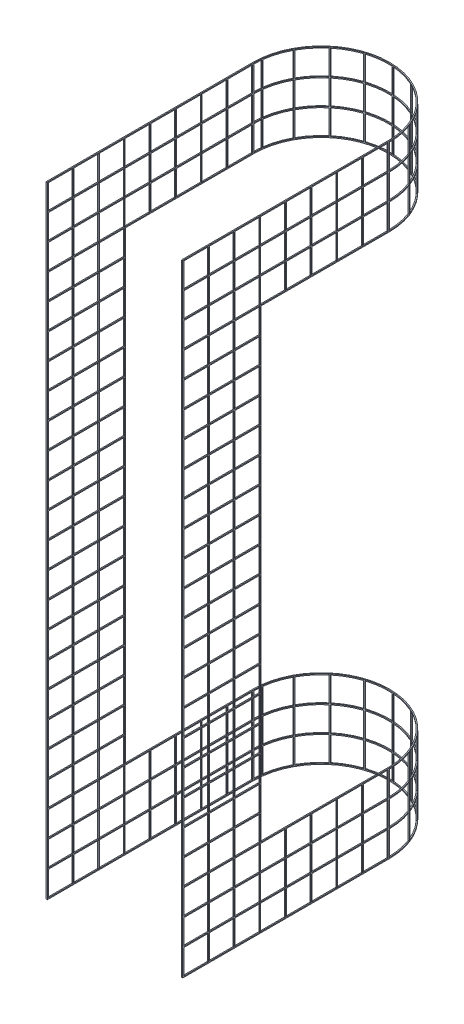
from build123d import *

# Parameters (mm, degrees)
BOSS_EXTRUDE1_DEPTH = 300.5
SKETCH2_W           = 12
SKETCH2_H           = 12
CUT_EXTRUDE2_DEPTH  = 324.506182321
WRAP3_START         = 0.5
WRAP3_DEPTH         = 12
WRAP3_START_2       = 13
WRAP3_2_DEPTH       = 12
WRAP3_START_3       = 25.5
WRAP3_3_DEPTH       = 12
WRAP3_START_4       = 263
WRAP3_4_DEPTH       = 12
WRAP3_START_5       = 275.5
WRAP3_5_DEPTH       = 12
WRAP3_START_6       = 288
WRAP3_6_DEPTH       = 12
SKETCH8_W           = 145.302396336
SKETCH8_H           = 224.5
CUT_EXTRUDE3_DEPTH  = 324.506182321


# Read off the part's stored shape, not the designer's step: Wrap3
with BuildPart() as part:
    # Sketch1 → Boss-Extrude1 (new body)
    with BuildSketch(Plane(origin=(0, 0, 0), x_dir=(1, 0, 0), z_dir=(0, 1, 0))):
        with BuildLine():
            Line((0, 0), (0, -100))
            Line((0, -100), (-0.5, -100))
            Line((-0.5, -100), (-0.5, 0))
            ThreePointArc((-0.5, 0), (32.5, 33), (65.5, 0))
            Line((65.5, 0), (65.5, -100))
            Line((65.5, -100), (65, -100))
            Line((65, -100), (65, 0))
            ThreePointArc((65, 0), (32.5, 32.5), (0, 0))
        make_face()
    extrude(amount=BOSS_EXTRUDE1_DEPTH)

    # Sketch2 → Cut-Extrude2 (cut, through all)
    with BuildSketch(Plane(origin=(65.5, 0, 0), x_dir=(0, 0, -1), z_dir=(1, 0, 0))):
        with Locations((-93.5, 294)):
            Rectangle(SKETCH2_W, SKETCH2_H)
        with Locations((-93.5, 281.5)):
            Rectangle(SKETCH2_W, SKETCH2_H)
        with Locations((-93.5, 269)):
            Rectangle(SKETCH2_W, SKETCH2_H)
        with Locations((-93.5, 256.5)):
            Rectangle(SKETCH2_W, SKETCH2_H)
        with Locations((-93.5, 244)):
            Rectangle(SKETCH2_W, SKETCH2_H)
        with Locations((-93.5, 231.5)):
            Rectangle(SKETCH2_W, SKETCH2_H)
        with Locations((-93.5, 219)):
            Rectangle(SKETCH2_W, SKETCH2_H)
        with Locations((-93.5, 206.5)):
            Rectangle(SKETCH2_W, SKETCH2_H)
        with Locations((-93.5, 194)):
            Rectangle(SKETCH2_W, SKETCH2_H)
        with Locations((-93.5, 181.5)):
            Rectangle(SKETCH2_W, SKETCH2_H)
        with Locations((-93.5, 169)):
            Rectangle(SKETCH2_W, SKETCH2_H)
        with Locations((-93.5, 156.5)):
            Rectangle(SKETCH2_W, SKETCH2_H)
        with Locations((-93.5, 144)):
            Rectangle(SKETCH2_W, SKETCH2_H)
        with Locations((-93.5, 131.5)):
            Rectangle(SKETCH2_W, SKETCH2_H)
        with Locations((-93.5, 119)):
            Rectangle(SKETCH2_W, SKETCH2_H)
        with Locations((-93.5, 106.5)):
            Rectangle(SKETCH2_W, SKETCH2_H)
        with Locations((-93.5, 94)):
            Rectangle(SKETCH2_W, SKETCH2_H)
        with Locations((-93.5, 81.5)):
            Rectangle(SKETCH2_W, SKETCH2_H)
        with Locations((-93.5, 69)):
            Rectangle(SKETCH2_W, SKETCH2_H)
        with Locations((-93.5, 56.5)):
            Rectangle(SKETCH2_W, SKETCH2_H)
        with Locations((-93.5, 44)):
            Rectangle(SKETCH2_W, SKETCH2_H)
        with Locations((-93.5, 31.5)):
            Rectangle(SKETCH2_W, SKETCH2_H)
        with Locations((-93.5, 19)):
            Rectangle(SKETCH2_W, SKETCH2_H)
        with Locations((-93.5, 6.5)):
            Rectangle(SKETCH2_W, SKETCH2_H)
        with Locations((-81.098058449, 294)):
            Rectangle(SKETCH2_W, SKETCH2_H)
        with Locations((-68.696116898, 294)):
            Rectangle(SKETCH2_W, SKETCH2_H)
        with Locations((-56.294175346, 294)):
            Rectangle(SKETCH2_W, SKETCH2_H)
        with Locations((-43.892233795, 294)):
            Rectangle(SKETCH2_W, SKETCH2_H)
        with Locations((-31.490292244, 294)):
            Rectangle(SKETCH2_W, SKETCH2_H)
        with Locations((-19.088350693, 294)):
            Rectangle(SKETCH2_W, SKETCH2_H)
        with Locations((-6.686409141, 294)):
            Rectangle(SKETCH2_W, SKETCH2_H)
        with Locations((-81.098058449, 281.5)):
            Rectangle(SKETCH2_W, SKETCH2_H)
        with Locations((-68.696116898, 281.5)):
            Rectangle(SKETCH2_W, SKETCH2_H)
        with Locations((-56.294175346, 281.5)):
            Rectangle(SKETCH2_W, SKETCH2_H)
        with Locations((-43.892233795, 281.5)):
            Rectangle(SKETCH2_W, SKETCH2_H)
        with Locations((-31.490292244, 281.5)):
            Rectangle(SKETCH2_W, SKETCH2_H)
        with Locations((-19.088350693, 281.5)):
            Rectangle(SKETCH2_W, SKETCH2_H)
        with Locations((-6.686409141, 281.5)):
            Rectangle(SKETCH2_W, SKETCH2_H)
        with Locations((-81.098058449, 269)):
            Rectangle(SKETCH2_W, SKETCH2_H)
        with Locations((-68.696116898, 269)):
            Rectangle(SKETCH2_W, SKETCH2_H)
        with Locations((-56.294175346, 269)):
            Rectangle(SKETCH2_W, SKETCH2_H)
        with Locations((-43.892233795, 269)):
            Rectangle(SKETCH2_W, SKETCH2_H)
        with Locations((-31.490292244, 269)):
            Rectangle(SKETCH2_W, SKETCH2_H)
        with Locations((-19.088350693, 269)):
            Rectangle(SKETCH2_W, SKETCH2_H)
        with Locations((-6.686409141, 269)):
            Rectangle(SKETCH2_W, SKETCH2_H)
        with Locations((-81.098058449, 256.5)):
            Rectangle(SKETCH2_W, SKETCH2_H)
        with Locations((-68.696116898, 256.5)):
            Rectangle(SKETCH2_W, SKETCH2_H)
        with Locations((-81.098058449, 244)):
            Rectangle(SKETCH2_W, SKETCH2_H)
        with Locations((-68.696116898, 244)):
            Rectangle(SKETCH2_W, SKETCH2_H)
        with Locations((-81.098058449, 231.5)):
            Rectangle(SKETCH2_W, SKETCH2_H)
        with Locations((-68.696116898, 231.5)):
            Rectangle(SKETCH2_W, SKETCH2_H)
        with Locations((-81.098058449, 219)):
            Rectangle(SKETCH2_W, SKETCH2_H)
        with Locations((-68.696116898, 219)):
            Rectangle(SKETCH2_W, SKETCH2_H)
        with Locations((-81.098058449, 206.5)):
            Rectangle(SKETCH2_W, SKETCH2_H)
        with Locations((-68.696116898, 206.5)):
            Rectangle(SKETCH2_W, SKETCH2_H)
        with Locations((-81.098058449, 194)):
            Rectangle(SKETCH2_W, SKETCH2_H)
        with Locations((-68.696116898, 194)):
            Rectangle(SKETCH2_W, SKETCH2_H)
        with Locations((-81.098058449, 181.5)):
            Rectangle(SKETCH2_W, SKETCH2_H)
        with Locations((-68.696116898, 181.5)):
            Rectangle(SKETCH2_W, SKETCH2_H)
        with Locations((-81.098058449, 169)):
            Rectangle(SKETCH2_W, SKETCH2_H)
        with Locations((-68.696116898, 169)):
            Rectangle(SKETCH2_W, SKETCH2_H)
        with Locations((-81.098058449, 156.5)):
            Rectangle(SKETCH2_W, SKETCH2_H)
        with Locations((-68.696116898, 156.5)):
            Rectangle(SKETCH2_W, SKETCH2_H)
        with Locations((-81.098058449, 144)):
            Rectangle(SKETCH2_W, SKETCH2_H)
        with Locations((-68.696116898, 144)):
            Rectangle(SKETCH2_W, SKETCH2_H)
        with Locations((-81.098058449, 131.5)):
            Rectangle(SKETCH2_W, SKETCH2_H)
        with Locations((-68.696116898, 131.5)):
            Rectangle(SKETCH2_W, SKETCH2_H)
        with Locations((-81.098058449, 119)):
            Rectangle(SKETCH2_W, SKETCH2_H)
        with Locations((-68.696116898, 119)):
            Rectangle(SKETCH2_W, SKETCH2_H)
        with Locations((-81.098058449, 106.5)):
            Rectangle(SKETCH2_W, SKETCH2_H)
        with Locations((-68.696116898, 106.5)):
            Rectangle(SKETCH2_W, SKETCH2_H)
        with Locations((-81.098058449, 94)):
            Rectangle(SKETCH2_W, SKETCH2_H)
        with Locations((-68.696116898, 94)):
            Rectangle(SKETCH2_W, SKETCH2_H)
        with Locations((-81.098058449, 81.5)):
            Rectangle(SKETCH2_W, SKETCH2_H)
        with Locations((-68.696116898, 81.5)):
            Rectangle(SKETCH2_W, SKETCH2_H)
        with Locations((-81.098058449, 69)):
            Rectangle(SKETCH2_W, SKETCH2_H)
        with Locations((-68.696116898, 69)):
            Rectangle(SKETCH2_W, SKETCH2_H)
        with Locations((-81.098058449, 56.5)):
            Rectangle(SKETCH2_W, SKETCH2_H)
        with Locations((-68.696116898, 56.5)):
            Rectangle(SKETCH2_W, SKETCH2_H)
        with Locations((-81.098058449, 44)):
            Rectangle(SKETCH2_W, SKETCH2_H)
        with Locations((-68.696116898, 44)):
            Rectangle(SKETCH2_W, SKETCH2_H)
        with Locations((-81.098058449, 31.5)):
            Rectangle(SKETCH2_W, SKETCH2_H)
        with Locations((-68.696116898, 31.5)):
            Rectangle(SKETCH2_W, SKETCH2_H)
        with Locations((-56.294175346, 31.5)):
            Rectangle(SKETCH2_W, SKETCH2_H)
        with Locations((-43.892233795, 31.5)):
            Rectangle(SKETCH2_W, SKETCH2_H)
        with Locations((-31.490292244, 31.5)):
            Rectangle(SKETCH2_W, SKETCH2_H)
        with Locations((-19.088350693, 31.5)):
            Rectangle(SKETCH2_W, SKETCH2_H)
        with Locations((-6.686409141, 31.5)):
            Rectangle(SKETCH2_W, SKETCH2_H)
        with Locations((-81.098058449, 19)):
            Rectangle(SKETCH2_W, SKETCH2_H)
        with Locations((-68.696116898, 19)):
            Rectangle(SKETCH2_W, SKETCH2_H)
        with Locations((-56.294175346, 19)):
            Rectangle(SKETCH2_W, SKETCH2_H)
        with Locations((-43.892233795, 19)):
            Rectangle(SKETCH2_W, SKETCH2_H)
        with Locations((-31.490292244, 19)):
            Rectangle(SKETCH2_W, SKETCH2_H)
        with Locations((-19.088350693, 19)):
            Rectangle(SKETCH2_W, SKETCH2_H)
        with Locations((-6.686409141, 19)):
            Rectangle(SKETCH2_W, SKETCH2_H)
        with Locations((-81.098058449, 6.5)):
            Rectangle(SKETCH2_W, SKETCH2_H)
        with Locations((-68.696116898, 6.5)):
            Rectangle(SKETCH2_W, SKETCH2_H)
        with Locations((-56.294175346, 6.5)):
            Rectangle(SKETCH2_W, SKETCH2_H)
        with Locations((-43.892233795, 6.5)):
            Rectangle(SKETCH2_W, SKETCH2_H)
        with Locations((-31.490292244, 6.5)):
            Rectangle(SKETCH2_W, SKETCH2_H)
        with Locations((-19.088350693, 6.5)):
            Rectangle(SKETCH2_W, SKETCH2_H)
        with Locations((-6.686409141, 6.5)):
            Rectangle(SKETCH2_W, SKETCH2_H)
    extrude(amount=-CUT_EXTRUDE2_DEPTH, mode=Mode.SUBTRACT)

    # Wrap3 outline → Wrap3 (cut)
    with BuildSketch(Plane(origin=(0, 0, 0), x_dir=(1, 0, 0), z_dir=(0, 1, 0)).offset(WRAP3_START)):
        with BuildLine():
            ThreePointArc((0, 0), (0.050302626, 1.807523255), (0.201054789, 3.609451239))
            Line((0.201054789, 3.609451239), (-0.295852061, 3.664981258))
            ThreePointArc((-0.295852061, 3.664981258), (-0.448923488, 1.835331305), (-0.5, 0))
            Line((-0.5, 0), (0, 0))
        make_face()
        with BuildLine():
            Line((-0.236559792, 4.161448421), (0.259448689, 4.098396173))
            ThreePointArc((0.259448689, 4.098396173), (1.531948072, 9.86051519), (3.825367602, 15.297563755))
            Line((3.825367602, 15.297563755), (3.384219411, 15.53291089))
            ThreePointArc((3.384219411, 15.53291089), (1.055516504, 10.012215423), (-0.236559792, 4.161448421))
        make_face()
        with BuildLine():
            Line((3.622899509, 15.972259303), (4.060431335, 15.730255374))
            ThreePointArc((4.060431335, 15.730255374), (7.373527928, 20.613354923), (11.514965987, 24.816896411))
            Line((11.514965987, 24.816896411), (11.19211931, 25.198694818))
            ThreePointArc((11.19211931, 25.198694818), (6.986966819, 20.930483461), (3.622899509, 15.972259303))
        make_face()
        with BuildLine():
            Line((11.57634887, 25.518636786), (11.893373887, 25.131990774))
            ThreePointArc((11.893373887, 25.131990774), (16.777360404, 28.443779709), (22.179673341, 30.817865884))
            Line((22.179673341, 30.817865884), (22.020899085, 31.291986898))
            ThreePointArc((22.020899085, 31.291986898), (16.535473641, 28.88137632), (11.57634887, 25.518636786))
        make_face()
        with BuildLine():
            Line((22.49620477, 31.447163322), (22.647777425, 30.97069115))
            ThreePointArc((22.647777425, 30.97069115), (28.41023697, 32.241647575), (34.307523255, 32.449697374))
            Line((34.307523255, 32.449697374), (34.335331305, 32.948923488))
            ThreePointArc((34.335331305, 32.948923488), (28.347317539, 32.737672922), (22.49620477, 31.447163322))
        make_face()
        with BuildLine():
            Line((34.834327655, 32.917334558), (34.798959054, 32.418587065))
            ThreePointArc((34.798959054, 32.418587065), (40.622931071, 31.46852381), (46.17911537, 29.481041411))
            Line((46.17911537, 29.481041411), (46.389563298, 29.934595895))
            ThreePointArc((46.389563298, 29.934595895), (40.747899241, 31.952654946), (34.834327655, 32.917334558))
        make_face()
        with BuildLine():
            Line((46.841506156, 29.720720065), (46.624210608, 29.270406125))
            ThreePointArc((46.624210608, 29.270406125), (51.68401374, 26.234016407), (56.111379733, 22.332772938))
            Line((56.111379733, 22.332772938), (56.474631729, 22.67635406))
            ThreePointArc((56.474631729, 22.67635406), (51.979152412, 26.637616659), (46.841506156, 29.720720065))
        make_face()
        with BuildLine():
            Line((56.815447849, 22.310513125), (56.447031972, 21.972475047))
            ThreePointArc((56.447031972, 21.972475047), (60.025323293, 17.280236619), (62.696190499, 12.018322651))
            Line((62.696190499, 12.018322651), (63.160747276, 12.203219922))
            ThreePointArc((63.160747276, 12.203219922), (60.448789805, 17.546086413), (56.815447849, 22.310513125))
        make_face()
        with BuildLine():
            Line((63.342118171, 11.73728021), (62.87481335, 11.559442631))
            ThreePointArc((62.87481335, 11.559442631), (64.46428815, 5.876587705), (65, 0))
            Line((65, 0), (65.5, 0))
            ThreePointArc((65.5, 0), (64.956046429, 5.966996747), (63.342118171, 11.73728021))
        make_face()
    extrude(amount=WRAP3_DEPTH, mode=Mode.SUBTRACT)

    # Wrap3 2 outline → Wrap3 2 (cut)
    with BuildSketch(Plane(origin=(0, 0, 0), x_dir=(1, 0, 0), z_dir=(0, 1, 0)).offset(WRAP3_START_2)):
        with BuildLine():
            ThreePointArc((0, 0), (0.050302626, 1.807523255), (0.201054789, 3.609451239))
            Line((0.201054789, 3.609451239), (-0.295852061, 3.664981258))
            ThreePointArc((-0.295852061, 3.664981258), (-0.448923488, 1.835331305), (-0.5, 0))
            Line((-0.5, 0), (0, 0))
        make_face()
        with BuildLine():
            Line((-0.236559792, 4.161448421), (0.259448689, 4.098396173))
            ThreePointArc((0.259448689, 4.098396173), (1.531948072, 9.86051519), (3.825367602, 15.297563755))
            Line((3.825367602, 15.297563755), (3.384219411, 15.53291089))
            ThreePointArc((3.384219411, 15.53291089), (1.055516504, 10.012215423), (-0.236559792, 4.161448421))
        make_face()
        with BuildLine():
            Line((3.622899509, 15.972259303), (4.060431335, 15.730255374))
            ThreePointArc((4.060431335, 15.730255374), (7.373527928, 20.613354923), (11.514965987, 24.816896411))
            Line((11.514965987, 24.816896411), (11.19211931, 25.198694818))
            ThreePointArc((11.19211931, 25.198694818), (6.986966819, 20.930483461), (3.622899509, 15.972259303))
        make_face()
        with BuildLine():
            Line((11.57634887, 25.518636786), (11.893373887, 25.131990774))
            ThreePointArc((11.893373887, 25.131990774), (16.777360404, 28.443779709), (22.179673341, 30.817865884))
            Line((22.179673341, 30.817865884), (22.020899085, 31.291986898))
            ThreePointArc((22.020899085, 31.291986898), (16.535473641, 28.88137632), (11.57634887, 25.518636786))
        make_face()
        with BuildLine():
            Line((22.49620477, 31.447163322), (22.647777425, 30.97069115))
            ThreePointArc((22.647777425, 30.97069115), (28.41023697, 32.241647575), (34.307523255, 32.449697374))
            Line((34.307523255, 32.449697374), (34.335331305, 32.948923488))
            ThreePointArc((34.335331305, 32.948923488), (28.347317539, 32.737672922), (22.49620477, 31.447163322))
        make_face()
        with BuildLine():
            Line((34.834327655, 32.917334558), (34.798959054, 32.418587065))
            ThreePointArc((34.798959054, 32.418587065), (40.622931071, 31.46852381), (46.17911537, 29.481041411))
            Line((46.17911537, 29.481041411), (46.389563298, 29.934595895))
            ThreePointArc((46.389563298, 29.934595895), (40.747899241, 31.952654946), (34.834327655, 32.917334558))
        make_face()
        with BuildLine():
            Line((46.841506156, 29.720720065), (46.624210608, 29.270406125))
            ThreePointArc((46.624210608, 29.270406125), (51.68401374, 26.234016407), (56.111379733, 22.332772938))
            Line((56.111379733, 22.332772938), (56.474631729, 22.67635406))
            ThreePointArc((56.474631729, 22.67635406), (51.979152412, 26.637616659), (46.841506156, 29.720720065))
        make_face()
        with BuildLine():
            Line((56.815447849, 22.310513125), (56.447031972, 21.972475047))
            ThreePointArc((56.447031972, 21.972475047), (60.025323293, 17.280236619), (62.696190499, 12.018322651))
            Line((62.696190499, 12.018322651), (63.160747276, 12.203219922))
            ThreePointArc((63.160747276, 12.203219922), (60.448789805, 17.546086413), (56.815447849, 22.310513125))
        make_face()
        with BuildLine():
            Line((63.342118171, 11.73728021), (62.87481335, 11.559442631))
            ThreePointArc((62.87481335, 11.559442631), (64.46428815, 5.876587705), (65, 0))
            Line((65, 0), (65.5, 0))
            ThreePointArc((65.5, 0), (64.956046429, 5.966996747), (63.342118171, 11.73728021))
        make_face()
    extrude(amount=WRAP3_2_DEPTH, mode=Mode.SUBTRACT)

    # Wrap3 3 outline → Wrap3 3 (cut)
    with BuildSketch(Plane(origin=(0, 0, 0), x_dir=(1, 0, 0), z_dir=(0, 1, 0)).offset(WRAP3_START_3)):
        with BuildLine():
            ThreePointArc((0, 0), (0.050302626, 1.807523255), (0.201054789, 3.609451239))
            Line((0.201054789, 3.609451239), (-0.295852061, 3.664981258))
            ThreePointArc((-0.295852061, 3.664981258), (-0.448923488, 1.835331305), (-0.5, 0))
            Line((-0.5, 0), (0, 0))
        make_face()
        with BuildLine():
            Line((-0.236559792, 4.161448421), (0.259448689, 4.098396173))
            ThreePointArc((0.259448689, 4.098396173), (1.531948072, 9.86051519), (3.825367602, 15.297563755))
            Line((3.825367602, 15.297563755), (3.384219411, 15.53291089))
            ThreePointArc((3.384219411, 15.53291089), (1.055516504, 10.012215423), (-0.236559792, 4.161448421))
        make_face()
        with BuildLine():
            Line((3.622899509, 15.972259303), (4.060431335, 15.730255374))
            ThreePointArc((4.060431335, 15.730255374), (7.373527928, 20.613354923), (11.514965987, 24.816896411))
            Line((11.514965987, 24.816896411), (11.19211931, 25.198694818))
            ThreePointArc((11.19211931, 25.198694818), (6.986966819, 20.930483461), (3.622899509, 15.972259303))
        make_face()
        with BuildLine():
            Line((11.57634887, 25.518636786), (11.893373887, 25.131990774))
            ThreePointArc((11.893373887, 25.131990774), (16.777360404, 28.443779709), (22.179673341, 30.817865884))
            Line((22.179673341, 30.817865884), (22.020899085, 31.291986898))
            ThreePointArc((22.020899085, 31.291986898), (16.535473641, 28.88137632), (11.57634887, 25.518636786))
        make_face()
        with BuildLine():
            Line((22.49620477, 31.447163322), (22.647777425, 30.97069115))
            ThreePointArc((22.647777425, 30.97069115), (28.41023697, 32.241647575), (34.307523255, 32.449697374))
            Line((34.307523255, 32.449697374), (34.335331305, 32.948923488))
            ThreePointArc((34.335331305, 32.948923488), (28.347317539, 32.737672922), (22.49620477, 31.447163322))
        make_face()
        with BuildLine():
            Line((34.834327655, 32.917334558), (34.798959054, 32.418587065))
            ThreePointArc((34.798959054, 32.418587065), (40.622931071, 31.46852381), (46.17911537, 29.481041411))
            Line((46.17911537, 29.481041411), (46.389563298, 29.934595895))
            ThreePointArc((46.389563298, 29.934595895), (40.747899241, 31.952654946), (34.834327655, 32.917334558))
        make_face()
        with BuildLine():
            Line((46.841506156, 29.720720065), (46.624210608, 29.270406125))
            ThreePointArc((46.624210608, 29.270406125), (51.68401374, 26.234016407), (56.111379733, 22.332772938))
            Line((56.111379733, 22.332772938), (56.474631729, 22.67635406))
            ThreePointArc((56.474631729, 22.67635406), (51.979152412, 26.637616659), (46.841506156, 29.720720065))
        make_face()
        with BuildLine():
            Line((56.815447849, 22.310513125), (56.447031972, 21.972475047))
            ThreePointArc((56.447031972, 21.972475047), (60.025323293, 17.280236619), (62.696190499, 12.018322651))
            Line((62.696190499, 12.018322651), (63.160747276, 12.203219922))
            ThreePointArc((63.160747276, 12.203219922), (60.448789805, 17.546086413), (56.815447849, 22.310513125))
        make_face()
        with BuildLine():
            Line((63.342118171, 11.73728021), (62.87481335, 11.559442631))
            ThreePointArc((62.87481335, 11.559442631), (64.46428815, 5.876587705), (65, 0))
            Line((65, 0), (65.5, 0))
            ThreePointArc((65.5, 0), (64.956046429, 5.966996747), (63.342118171, 11.73728021))
        make_face()
    extrude(amount=WRAP3_3_DEPTH, mode=Mode.SUBTRACT)

    # Wrap3 4 outline → Wrap3 4 (cut)
    with BuildSketch(Plane(origin=(0, 0, 0), x_dir=(1, 0, 0), z_dir=(0, 1, 0)).offset(WRAP3_START_4)):
        with BuildLine():
            ThreePointArc((0, 0), (0.050302626, 1.807523255), (0.201054789, 3.609451239))
            Line((0.201054789, 3.609451239), (-0.295852061, 3.664981258))
            ThreePointArc((-0.295852061, 3.664981258), (-0.448923488, 1.835331305), (-0.5, 0))
            Line((-0.5, 0), (0, 0))
        make_face()
        with BuildLine():
            Line((-0.236559792, 4.161448421), (0.259448689, 4.098396173))
            ThreePointArc((0.259448689, 4.098396173), (1.531948072, 9.86051519), (3.825367602, 15.297563755))
            Line((3.825367602, 15.297563755), (3.384219411, 15.53291089))
            ThreePointArc((3.384219411, 15.53291089), (1.055516504, 10.012215423), (-0.236559792, 4.161448421))
        make_face()
        with BuildLine():
            Line((3.622899509, 15.972259303), (4.060431335, 15.730255374))
            ThreePointArc((4.060431335, 15.730255374), (7.373527928, 20.613354923), (11.514965987, 24.816896411))
            Line((11.514965987, 24.816896411), (11.19211931, 25.198694818))
            ThreePointArc((11.19211931, 25.198694818), (6.986966819, 20.930483461), (3.622899509, 15.972259303))
        make_face()
        with BuildLine():
            Line((11.57634887, 25.518636786), (11.893373887, 25.131990774))
            ThreePointArc((11.893373887, 25.131990774), (16.777360404, 28.443779709), (22.179673341, 30.817865884))
            Line((22.179673341, 30.817865884), (22.020899085, 31.291986898))
            ThreePointArc((22.020899085, 31.291986898), (16.535473641, 28.88137632), (11.57634887, 25.518636786))
        make_face()
        with BuildLine():
            Line((22.49620477, 31.447163322), (22.647777425, 30.97069115))
            ThreePointArc((22.647777425, 30.97069115), (28.41023697, 32.241647575), (34.307523255, 32.449697374))
            Line((34.307523255, 32.449697374), (34.335331305, 32.948923488))
            ThreePointArc((34.335331305, 32.948923488), (28.347317539, 32.737672922), (22.49620477, 31.447163322))
        make_face()
        with BuildLine():
            Line((34.834327655, 32.917334558), (34.798959054, 32.418587065))
            ThreePointArc((34.798959054, 32.418587065), (40.622931071, 31.46852381), (46.17911537, 29.481041411))
            Line((46.17911537, 29.481041411), (46.389563298, 29.934595895))
            ThreePointArc((46.389563298, 29.934595895), (40.747899241, 31.952654946), (34.834327655, 32.917334558))
        make_face()
        with BuildLine():
            Line((46.841506156, 29.720720065), (46.624210608, 29.270406125))
            ThreePointArc((46.624210608, 29.270406125), (51.68401374, 26.234016407), (56.111379733, 22.332772938))
            Line((56.111379733, 22.332772938), (56.474631729, 22.67635406))
            ThreePointArc((56.474631729, 22.67635406), (51.979152412, 26.637616659), (46.841506156, 29.720720065))
        make_face()
        with BuildLine():
            Line((56.815447849, 22.310513125), (56.447031972, 21.972475047))
            ThreePointArc((56.447031972, 21.972475047), (60.025323293, 17.280236619), (62.696190499, 12.018322651))
            Line((62.696190499, 12.018322651), (63.160747276, 12.203219922))
            ThreePointArc((63.160747276, 12.203219922), (60.448789805, 17.546086413), (56.815447849, 22.310513125))
        make_face()
        with BuildLine():
            Line((63.342118171, 11.73728021), (62.87481335, 11.559442631))
            ThreePointArc((62.87481335, 11.559442631), (64.46428815, 5.876587705), (65, 0))
            Line((65, 0), (65.5, 0))
            ThreePointArc((65.5, 0), (64.956046429, 5.966996747), (63.342118171, 11.73728021))
        make_face()
    extrude(amount=WRAP3_4_DEPTH, mode=Mode.SUBTRACT)

    # Wrap3 5 outline → Wrap3 5 (cut)
    with BuildSketch(Plane(origin=(0, 0, 0), x_dir=(1, 0, 0), z_dir=(0, 1, 0)).offset(WRAP3_START_5)):
        with BuildLine():
            ThreePointArc((0, 0), (0.050302626, 1.807523255), (0.201054789, 3.609451239))
            Line((0.201054789, 3.609451239), (-0.295852061, 3.664981258))
            ThreePointArc((-0.295852061, 3.664981258), (-0.448923488, 1.835331305), (-0.5, 0))
            Line((-0.5, 0), (0, 0))
        make_face()
        with BuildLine():
            Line((-0.236559792, 4.161448421), (0.259448689, 4.098396173))
            ThreePointArc((0.259448689, 4.098396173), (1.531948072, 9.86051519), (3.825367602, 15.297563755))
            Line((3.825367602, 15.297563755), (3.384219411, 15.53291089))
            ThreePointArc((3.384219411, 15.53291089), (1.055516504, 10.012215423), (-0.236559792, 4.161448421))
        make_face()
        with BuildLine():
            Line((3.622899509, 15.972259303), (4.060431335, 15.730255374))
            ThreePointArc((4.060431335, 15.730255374), (7.373527928, 20.613354923), (11.514965987, 24.816896411))
            Line((11.514965987, 24.816896411), (11.19211931, 25.198694818))
            ThreePointArc((11.19211931, 25.198694818), (6.986966819, 20.930483461), (3.622899509, 15.972259303))
        make_face()
        with BuildLine():
            Line((11.57634887, 25.518636786), (11.893373887, 25.131990774))
            ThreePointArc((11.893373887, 25.131990774), (16.777360404, 28.443779709), (22.179673341, 30.817865884))
            Line((22.179673341, 30.817865884), (22.020899085, 31.291986898))
            ThreePointArc((22.020899085, 31.291986898), (16.535473641, 28.88137632), (11.57634887, 25.518636786))
        make_face()
        with BuildLine():
            Line((22.49620477, 31.447163322), (22.647777425, 30.97069115))
            ThreePointArc((22.647777425, 30.97069115), (28.41023697, 32.241647575), (34.307523255, 32.449697374))
            Line((34.307523255, 32.449697374), (34.335331305, 32.948923488))
            ThreePointArc((34.335331305, 32.948923488), (28.347317539, 32.737672922), (22.49620477, 31.447163322))
        make_face()
        with BuildLine():
            Line((34.834327655, 32.917334558), (34.798959054, 32.418587065))
            ThreePointArc((34.798959054, 32.418587065), (40.622931071, 31.46852381), (46.17911537, 29.481041411))
            Line((46.17911537, 29.481041411), (46.389563298, 29.934595895))
            ThreePointArc((46.389563298, 29.934595895), (40.747899241, 31.952654946), (34.834327655, 32.917334558))
        make_face()
        with BuildLine():
            Line((46.841506156, 29.720720065), (46.624210608, 29.270406125))
            ThreePointArc((46.624210608, 29.270406125), (51.68401374, 26.234016407), (56.111379733, 22.332772938))
            Line((56.111379733, 22.332772938), (56.474631729, 22.67635406))
            ThreePointArc((56.474631729, 22.67635406), (51.979152412, 26.637616659), (46.841506156, 29.720720065))
        make_face()
        with BuildLine():
            Line((56.815447849, 22.310513125), (56.447031972, 21.972475047))
            ThreePointArc((56.447031972, 21.972475047), (60.025323293, 17.280236619), (62.696190499, 12.018322651))
            Line((62.696190499, 12.018322651), (63.160747276, 12.203219922))
            ThreePointArc((63.160747276, 12.203219922), (60.448789805, 17.546086413), (56.815447849, 22.310513125))
        make_face()
        with BuildLine():
            Line((63.342118171, 11.73728021), (62.87481335, 11.559442631))
            ThreePointArc((62.87481335, 11.559442631), (64.46428815, 5.876587705), (65, 0))
            Line((65, 0), (65.5, 0))
            ThreePointArc((65.5, 0), (64.956046429, 5.966996747), (63.342118171, 11.73728021))
        make_face()
    extrude(amount=WRAP3_5_DEPTH, mode=Mode.SUBTRACT)

    # Wrap3 6 outline → Wrap3 6 (cut)
    with BuildSketch(Plane(origin=(0, 0, 0), x_dir=(1, 0, 0), z_dir=(0, 1, 0)).offset(WRAP3_START_6)):
        with BuildLine():
            ThreePointArc((0, 0), (0.050302626, 1.807523255), (0.201054789, 3.609451239))
            Line((0.201054789, 3.609451239), (-0.295852061, 3.664981258))
            ThreePointArc((-0.295852061, 3.664981258), (-0.448923488, 1.835331305), (-0.5, 0))
            Line((-0.5, 0), (0, 0))
        make_face()
        with BuildLine():
            Line((-0.236559792, 4.161448421), (0.259448689, 4.098396173))
            ThreePointArc((0.259448689, 4.098396173), (1.531948072, 9.86051519), (3.825367602, 15.297563755))
            Line((3.825367602, 15.297563755), (3.384219411, 15.53291089))
            ThreePointArc((3.384219411, 15.53291089), (1.055516504, 10.012215423), (-0.236559792, 4.161448421))
        make_face()
        with BuildLine():
            Line((3.622899509, 15.972259303), (4.060431335, 15.730255374))
            ThreePointArc((4.060431335, 15.730255374), (7.373527928, 20.613354923), (11.514965987, 24.816896411))
            Line((11.514965987, 24.816896411), (11.19211931, 25.198694818))
            ThreePointArc((11.19211931, 25.198694818), (6.986966819, 20.930483461), (3.622899509, 15.972259303))
        make_face()
        with BuildLine():
            Line((11.57634887, 25.518636786), (11.893373887, 25.131990774))
            ThreePointArc((11.893373887, 25.131990774), (16.777360404, 28.443779709), (22.179673341, 30.817865884))
            Line((22.179673341, 30.817865884), (22.020899085, 31.291986898))
            ThreePointArc((22.020899085, 31.291986898), (16.535473641, 28.88137632), (11.57634887, 25.518636786))
        make_face()
        with BuildLine():
            Line((22.49620477, 31.447163322), (22.647777425, 30.97069115))
            ThreePointArc((22.647777425, 30.97069115), (28.41023697, 32.241647575), (34.307523255, 32.449697374))
            Line((34.307523255, 32.449697374), (34.335331305, 32.948923488))
            ThreePointArc((34.335331305, 32.948923488), (28.347317539, 32.737672922), (22.49620477, 31.447163322))
        make_face()
        with BuildLine():
            Line((34.834327655, 32.917334558), (34.798959054, 32.418587065))
            ThreePointArc((34.798959054, 32.418587065), (40.622931071, 31.46852381), (46.17911537, 29.481041411))
            Line((46.17911537, 29.481041411), (46.389563298, 29.934595895))
            ThreePointArc((46.389563298, 29.934595895), (40.747899241, 31.952654946), (34.834327655, 32.917334558))
        make_face()
        with BuildLine():
            Line((46.841506156, 29.720720065), (46.624210608, 29.270406125))
            ThreePointArc((46.624210608, 29.270406125), (51.68401374, 26.234016407), (56.111379733, 22.332772938))
            Line((56.111379733, 22.332772938), (56.474631729, 22.67635406))
            ThreePointArc((56.474631729, 22.67635406), (51.979152412, 26.637616659), (46.841506156, 29.720720065))
        make_face()
        with BuildLine():
            Line((56.815447849, 22.310513125), (56.447031972, 21.972475047))
            ThreePointArc((56.447031972, 21.972475047), (60.025323293, 17.280236619), (62.696190499, 12.018322651))
            Line((62.696190499, 12.018322651), (63.160747276, 12.203219922))
            ThreePointArc((63.160747276, 12.203219922), (60.448789805, 17.546086413), (56.815447849, 22.310513125))
        make_face()
        with BuildLine():
            Line((63.342118171, 11.73728021), (62.87481335, 11.559442631))
            ThreePointArc((62.87481335, 11.559442631), (64.46428815, 5.876587705), (65, 0))
            Line((65, 0), (65.5, 0))
            ThreePointArc((65.5, 0), (64.956046429, 5.966996747), (63.342118171, 11.73728021))
        make_face()
    extrude(amount=WRAP3_6_DEPTH, mode=Mode.SUBTRACT)

    # Sketch8 → Cut-Extrude3 (cut, through all)
    with BuildSketch(Plane(origin=(65.5, 0, 0), x_dir=(0, 0, -1), z_dir=(1, 0, 0))):
        with Locations((10.45508127, 150.25)):
            Rectangle(SKETCH8_W, SKETCH8_H)
    extrude(amount=-CUT_EXTRUDE3_DEPTH, mode=Mode.SUBTRACT)


solid = part.part
